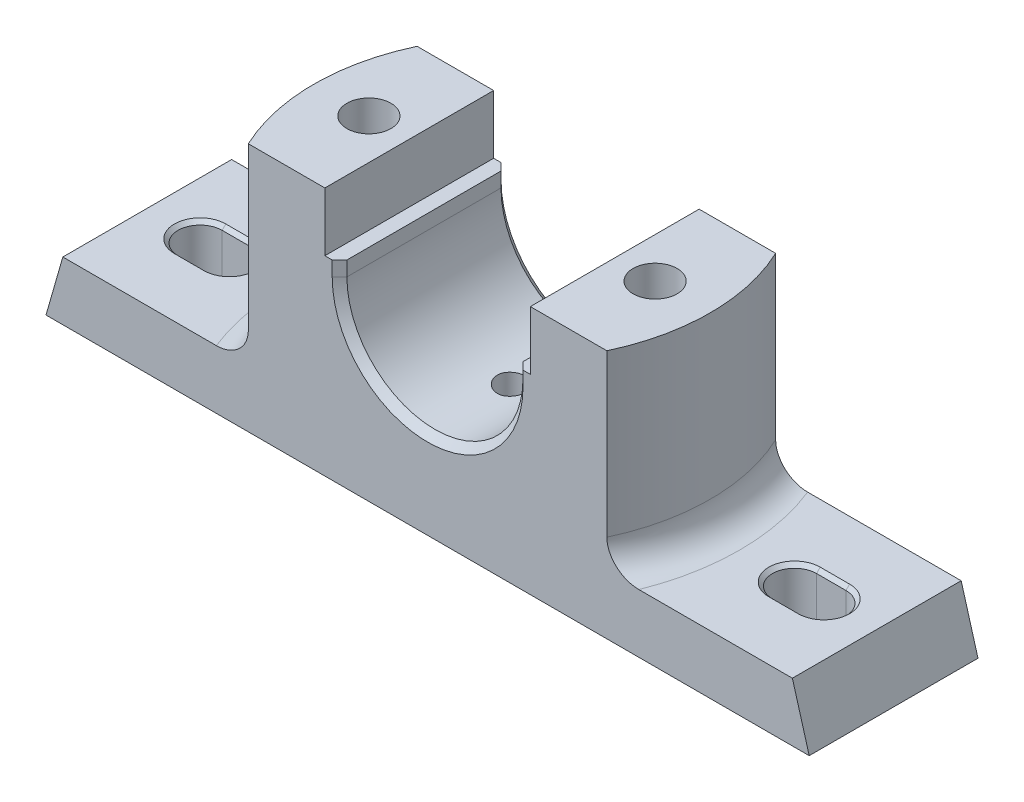
from build123d import *

# Parameters (mm, degrees)
BOSS_EXTRUDE1_DEPTH = 23
CUT_EXTRUDE1_START  = -52
CUT_EXTRUDE1_DEPTH  = 52
SKETCH3_W           = 195
SKETCH3_H           = 35
CUT_EXTRUDE2_DEPTH  = 2
FILLET1_R           = 8
CUT_EXTRUDE3_REACH  = 120.528
CHAMFER1_SIZE       = 1
SKETCH16_W          = 28
SKETCH16_H          = 28
SKETCH16_R          = 6
CUT_EXTRUDE4_DEPTH  = 10
SKETCH16_3_R        = 6
CUT_EXTRUDE5_DEPTH  = 126.303631386
CHAMFER2_SIZE       = 2
SKETCH20_W          = 4
SKETCH20_H          = 9


# Read off the part's stored shape, not the designer's step: Cut-Extrude1
with BuildPart() as part:
    # Sketch1 → Boss-Extrude1 (new, symmetric)
    with BuildSketch(Plane.XY):
        Polygon((-104, 0), (104, 0), (99.412073828, 16), (-99.412073828, 16), align=None)
        with BuildLine():
            Line((-54, 68), (-54, 16))
            Line((-54, 16), (54, 16))
            Line((54, 16), (54, 68))
            Line((54, 68), (28, 68))
            Line((28, 68), (28, 52))
            Line((28, 52), (24, 52))
            Line((24, 52), (24, 48))
            ThreePointArc((24, 48), (0, 24), (-24, 48))
            Line((-24, 48), (-24, 52))
            Line((-24, 52), (-28, 52))
            Line((-28, 52), (-28, 68))
            Line((-28, 68), (-54, 68))
        make_face()
    extrude(amount=BOSS_EXTRUDE1_DEPTH, both=True)

    # Cut-Extrude1 outline → Cut-Extrude1 (cut)
    with BuildSketch(Plane(origin=(0, 68, 0), x_dir=(1, 0, 0), z_dir=(0, 1, 0)).offset(CUT_EXTRUDE1_START)):
        with BuildLine():
            ThreePointArc((-54, 0), (-52.698550436, 11.784005345), (-48.856934001, 23))
            Line((-48.856934001, 23), (-54, 23))
            Line((-54, 23), (-54, 0))
        make_face()
        with BuildLine():
            ThreePointArc((-48.856934001, -23), (-52.698550436, -11.784005345), (-54, 0))
            Line((-54, 0), (-54, -23))
            Line((-54, -23), (-48.856934001, -23))
        make_face()
        with BuildLine():
            Line((54, 23), (48.856934001, 23))
            ThreePointArc((48.856934001, 23), (52.698550436, 11.784005345), (54, 0))
            Line((54, 0), (54, 23))
        make_face()
        with BuildLine():
            Line((54, -23), (54, 0))
            ThreePointArc((54, 0), (52.698550436, -11.784005345), (48.856934001, -23))
            Line((48.856934001, -23), (54, -23))
        make_face()
    extrude(amount=CUT_EXTRUDE1_DEPTH, mode=Mode.SUBTRACT)

    # Sketch3 → Cut-Extrude2 (cut)
    with BuildSketch(Plane.XZ):
        Rectangle(SKETCH3_W, SKETCH3_H)
    extrude(amount=-CUT_EXTRUDE2_DEPTH, mode=Mode.SUBTRACT)

    # Fillet1
    fillet1_edges = [part.edges().sort_by_distance(p)[0] for p in [
        (52.698550436, 16, -11.784005345),
        (-52.698550436, 16, -11.784005345),
    ]]
    fillet(fillet1_edges, radius=FILLET1_R)

    # Sketch4 → Cut-Extrude3 (cut, up to next)
    with BuildSketch(Plane(origin=(0, 16, 0), x_dir=(1, 0, 0), z_dir=(0, 1, 0)), mode=Mode.PRIVATE) as cut_extrude3_sk1:
        with BuildLine():
            Line((-85, 6), (-77, 6))
            ThreePointArc((-77, 6), (-71, 0), (-77, -6))
            Line((-77, -6), (-85, -6))
            ThreePointArc((-85, -6), (-91, 0), (-85, 6))
        make_face()
    cut_extrude3_tool1 = extrude(cut_extrude3_sk1.sketch, amount=-CUT_EXTRUDE3_REACH, mode=Mode.PRIVATE) & part.part
    # Sketch4 → Cut-Extrude3 (cut, up to next)
    with BuildSketch(Plane(origin=(0, 16, 0), x_dir=(1, 0, 0), z_dir=(0, 1, 0)), mode=Mode.PRIVATE) as cut_extrude3_sk2:
        with BuildLine():
            Line((85, 6), (77, 6))
            ThreePointArc((77, 6), (71, 0), (77, -6))
            Line((77, -6), (85, -6))
            ThreePointArc((85, -6), (91, 0), (85, 6))
        make_face()
    cut_extrude3_tool2 = extrude(cut_extrude3_sk2.sketch, amount=-CUT_EXTRUDE3_REACH, mode=Mode.PRIVATE) & part.part
    add(cut_extrude3_tool1.solids().sort_by_distance((-81, 16, 0))[0], mode=Mode.SUBTRACT)
    add(cut_extrude3_tool2.solids().sort_by_distance((81, 16, 0))[0], mode=Mode.SUBTRACT)

    # Chamfer1
    chamfer1_edges = [part.edges().sort_by_distance(p)[0] for p in [
        (-91, 16, 0),
        (-81, 16, 6),
        (-71, 16, 0),
        (-81, 16, -6),
        (-81, 2, 6),
        (-91, 2, 0),
        (-81, 2, -6),
        (-71, 2, 0),
        (91, 16, 0),
        (81, 16, -6),
        (71, 16, 0),
        (81, 16, 6),
        (81, 2, -6),
        (91, 2, 0),
        (81, 2, 6),
        (71, 2, 0),
    ]]
    chamfer(chamfer1_edges, length=CHAMFER1_SIZE)

    # Sketch16 → Cut-Extrude4 (cut)
    # profile 1 of 2: a face of its own
    with BuildSketch(Plane.XZ.offset(-2)):
        with Locations((-39, 0)):
            Rectangle(SKETCH16_W, SKETCH16_H)
        with Locations(Location((-39, 0, 0), (0, 0, 270))):
            Circle(SKETCH16_R, mode=Mode.SUBTRACT)
    # profile 2 of 2: a face of its own
    with BuildSketch(Plane.XZ.offset(-2)):
        with Locations((39, 0)):
            Rectangle(SKETCH16_W, SKETCH16_H)
        with Locations(Location((39, 0, 0), (0, 0, 270))):
            Circle(SKETCH16_R, mode=Mode.SUBTRACT)
    extrude(amount=-CUT_EXTRUDE4_DEPTH, mode=Mode.SUBTRACT)

    # Sketch16<3> → Cut-Extrude5 (cut, through all)
    with BuildSketch(Plane.XZ.offset(-2)):
        with Locations(Location((-39, 0, 0), (0, 0, 270))):
            Circle(SKETCH16_3_R)
        with Locations(Location((39, 0, 0), (0, 0, 270))):
            Circle(SKETCH16_3_R)
    extrude(amount=-CUT_EXTRUDE5_DEPTH, mode=Mode.SUBTRACT)

    # Chamfer2
    chamfer2_edges = [part.edges().sort_by_distance(p)[0] for p in [
        (-24, 50, -23),
        (0, 24, -23),
        (24, 50, -23),
        (24, 50, 23),
        (0, 24, 23),
        (-24, 50, 23),
    ]]
    chamfer(chamfer2_edges, length=CHAMFER2_SIZE)

    # Sketch20 → Ø8.0mm Dowel Hole5 (revolve, cut)
    with BuildSketch(Plane(origin=(0, 16, 0), x_dir=(0, 0, -1), z_dir=(1, 0, 0))):
        with Locations((2, 4.5)):
            Rectangle(SKETCH20_W, SKETCH20_H)
    revolve(axis=Axis((0, 9.65, 0), (0, 1, 0)), mode=Mode.SUBTRACT)


solid = part.part
